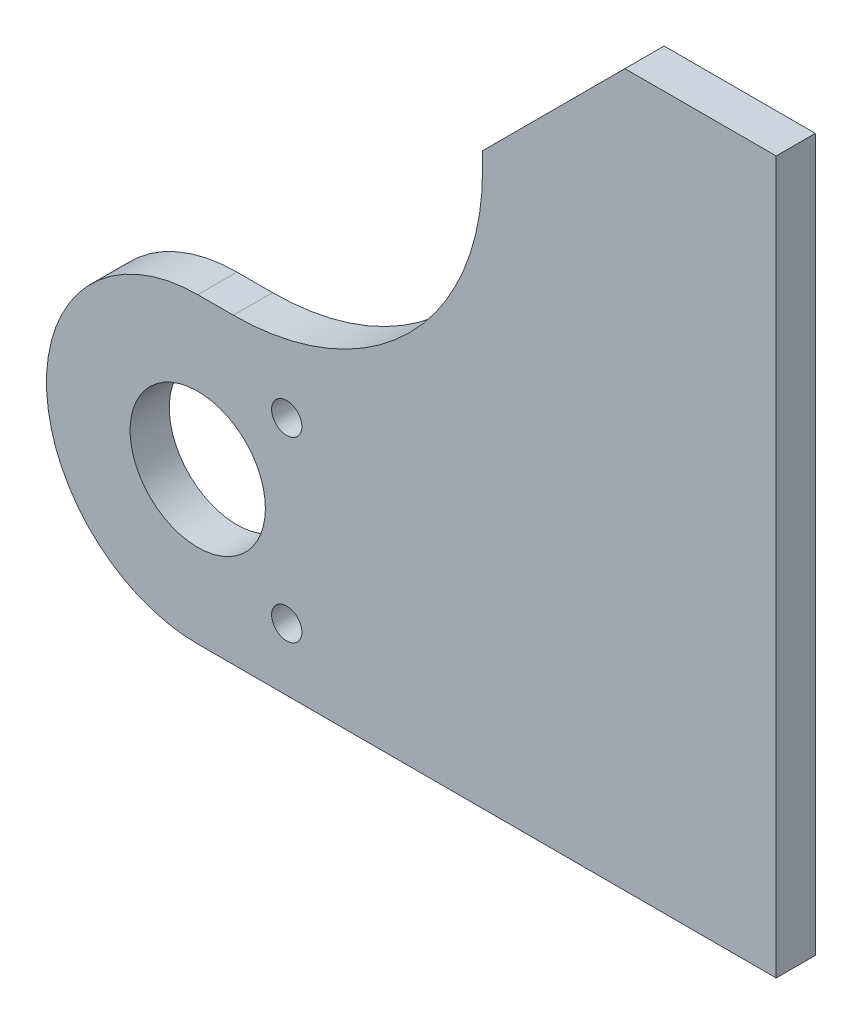
from build123d import *

# Parameters (mm, degrees)
AUFSATZ_LINEAR_AUSTRAGEN1_DEPTH      = 4
AUFSATZ_LINEAR_AUSTRAGEN1_DEPTH_BACK = 7
SKIZZE1_R                            = 19
M10_GEWINDEBOHRUNG1_D                = 8.5


with BuildPart() as part:
    # Skizze1 → Aufsatz-Linear austragen1 (new, two sides: drawn at the far end of the back side and taken through both)
    with BuildSketch(Plane.XY.offset(-AUFSATZ_LINEAR_AUSTRAGEN1_DEPTH_BACK)):
        with BuildLine():
            Line((0, 42.5), (10, 42.5))
            ThreePointArc((10, 42.5), (59.497474683, 63.002525317), (80, 112.5))
            Line((80, 112.5), (80, 117.5))
            Line((80, 117.5), (120, 157.5))
            Line((120, 157.5), (162.5, 157.5))
            Line((162.5, 157.5), (162.5, -42.5))
            Line((162.5, -42.5), (0, -42.5))
            ThreePointArc((0, -42.5), (-42.5, 0), (0, 42.5))
        make_face()
        Circle(SKIZZE1_R, mode=Mode.SUBTRACT)
    extrude(amount=AUFSATZ_LINEAR_AUSTRAGEN1_DEPTH + AUFSATZ_LINEAR_AUSTRAGEN1_DEPTH_BACK)

    # M10 Gewindebohrung1 (through all)
    with Locations(Plane.XY.offset(4)):
        with Locations((25, -25), (25, 25)):
            Hole(M10_GEWINDEBOHRUNG1_D / 2)


solid = part.part
